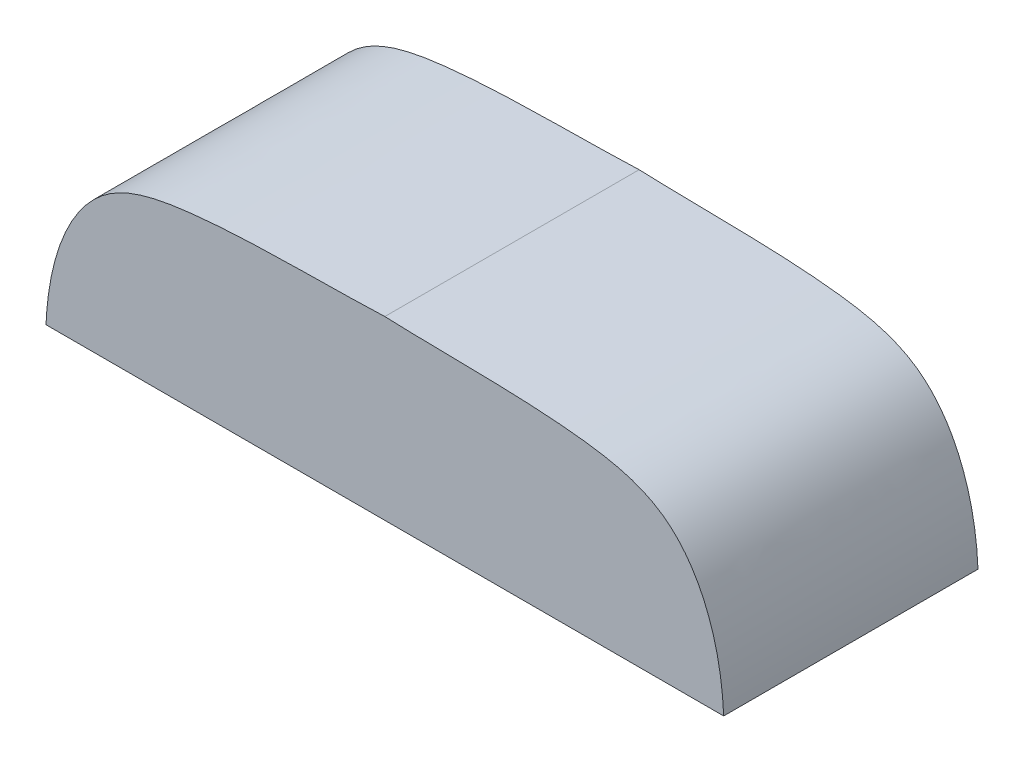
from build123d import *

# Parameters (mm, degrees)
BOSS_EXTRUDE1_DEPTH      = 127
BOSS_EXTRUDE1_DEPTH_BACK = 127


with BuildPart() as part:
    # Sketch1 → Boss-Extrude1 (new, two sides: drawn at the far end of the back side and taken through both)
    with BuildSketch(Plane.XY.offset(-BOSS_EXTRUDE1_DEPTH_BACK)):
        with BuildLine():
            Line((0, 55.943822519), (-338.420140941, 55.943822519))
            add(Edge.make_bspline(
                [(0, 232.258315543), (-56.542000297, 229.74112864), (-174.485235663, 232.87446935), (-302.766948324, 203.903921333), (-335.826259434, 117.861475814), (-338.420140941, 55.943822519)],
                knots=[0, 0, 0, 0, 0.225226498, 0.337839747, 0.524743478, 0.524743478, 0.524743478, 0.524743478], degree=3))
            add(Edge.make_bspline(
                [(0, 232.258315543), (56.542000297, 229.74112864), (174.485235663, 232.87446935), (302.766948324, 203.903921333), (335.826259434, 117.861475814), (338.420140941, 55.943822519)],
                knots=[0, 0, 0, 0, 0.225226498, 0.337839747, 0.524743478, 0.524743478, 0.524743478, 0.524743478], degree=3))
            Line((338.420140941, 55.943822519), (0, 55.943822519))
        make_face()
    extrude(amount=BOSS_EXTRUDE1_DEPTH + BOSS_EXTRUDE1_DEPTH_BACK)


solid = part.part
